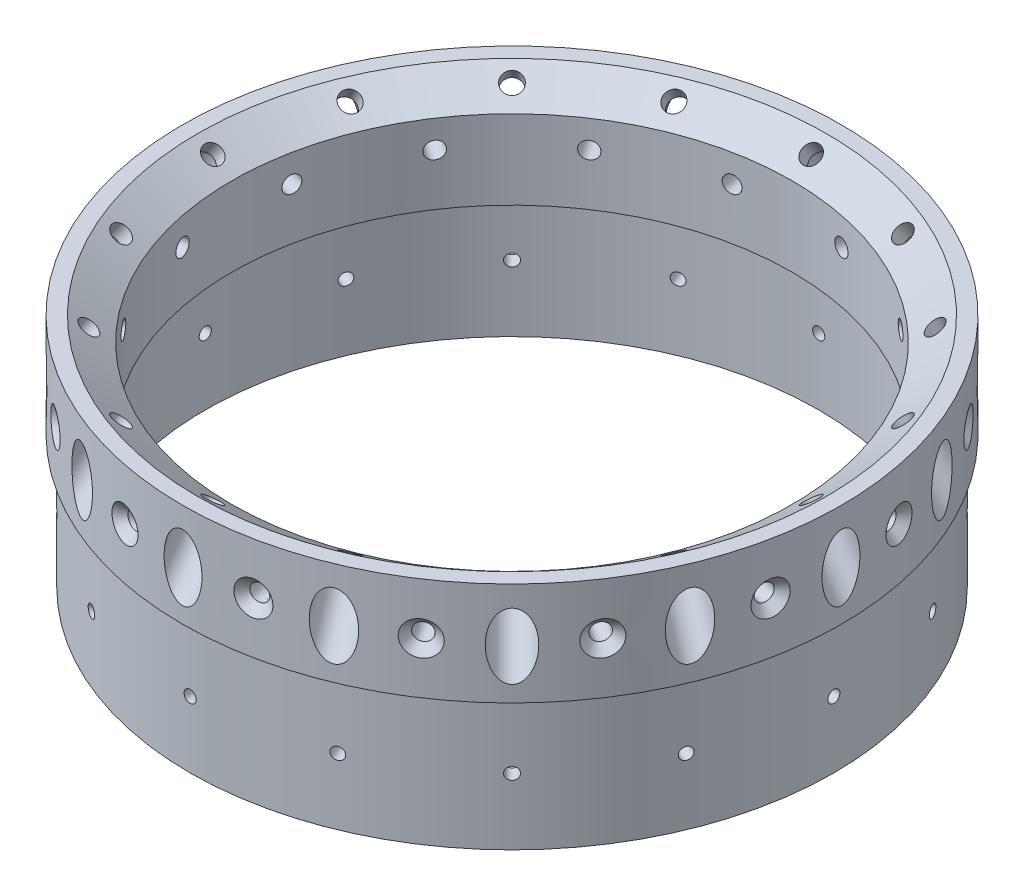
from build123d import *

# Parameters (mm, degrees)
HOLE_START                = -3
SKETCH14_R                = 5
HOLE_EXTRUDE_1_DEPTH      = 150.91522103
SCREW_EXTRUDE_D           = 5
SCREW_HOLES_PATTERN_COUNT = 16
CUT_EXTRUDE1_REACH        = 197.903
CUT_EXTRUDE1_END_RADIUS   = 81
SKETCH16_R                = 1.6
CIRPATTERN1_COUNT         = 16
CIRPATTERN2_COUNT         = 16


with BuildPart() as part:
    # Main sketch → Main revolve (revolve)
    with BuildSketch(Plane.XY, mode=Mode.PRIVATE) as main_revolve_sk:
        Polygon((-85, -35), (-81, -35), (-81, 0), (-74, 0), (-74, 20.897302003), (-83, 27.199169847), (-87, 27.199169847), (-87, 0), (-85, 0), align=None)
    revolve(main_revolve_sk.sketch.rotate(Axis((0, 0, 0), (0, -1, 0)), 270), axis=Axis((0, 0, 0), (0, -1, 0)))

    # Sketch14 → Hole extrude 1 (cut)
    with BuildSketch(Plane(origin=(-18.526734454, -26.458918881, 0), x_dir=(0.8191520442889891, -0.5735764363510499, 0), z_dir=(-0.5735764363510499, -0.8191520442889891, 0)).offset(HOLE_START)):
        with Locations(Location((-78.707324234, 0, 0), (0, 0, 180))):
            Circle(SKETCH14_R)
    hole_extrude_1 = extrude(amount=HOLE_EXTRUDE_1_DEPTH, mode=Mode.SUBTRACT)

    # screw extrude (through all)
    with Locations(Plane(origin=(-81.279270691, 21.1432038, 0), x_dir=(-0.819152044289, 0.573576436351, 0), z_dir=(-0.573576436351, -0.819152044289, 0))):
        with Locations((0, 0)):
            screw_extrude = Hole(SCREW_EXTRUDE_D / 2)

    # Screw holes pattern: Hole extrude 1, screw extrude ×16 about axis
    screw_holes_pattern_axis = Axis((0, 0, 0), (0, 1, 0))
    add([hole_extrude_1.rotate(screw_holes_pattern_axis, i * 360 / SCREW_HOLES_PATTERN_COUNT) for i in range(1, SCREW_HOLES_PATTERN_COUNT)], mode=Mode.SUBTRACT)
    add([screw_extrude.rotate(screw_holes_pattern_axis, i * 360 / SCREW_HOLES_PATTERN_COUNT) for i in range(1, SCREW_HOLES_PATTERN_COUNT)], mode=Mode.SUBTRACT)

    # Cut-Extrude1: up to this cylinder (the profile starts outside it)
    cut_extrude1_end = Plane(origin=(0, -17.5, 0), z_dir=(0, 1, 0)) * Cylinder(CUT_EXTRUDE1_END_RADIUS, 558.806, mode=Mode.PRIVATE)
    # Sketch16 → Cut-Extrude1 (cut, up to the surface)
    with BuildSketch(Plane.XY.offset(85), mode=Mode.PRIVATE) as cut_extrude1_sk1:
        with Locations((0, -17.5)):
            Circle(SKETCH16_R)
    cut_extrude1_tool1 = extrude(cut_extrude1_sk1.sketch, amount=-CUT_EXTRUDE1_REACH, mode=Mode.PRIVATE) - cut_extrude1_end
    cut_extrude1 = cut_extrude1_tool1.solids().sort_by_distance((0, -17.5, 85))[0]
    add(cut_extrude1, mode=Mode.SUBTRACT)

    # CirPattern1: Cut-Extrude1 ×16 about axis
    cirpattern1_axis = Axis((0, -35, 0), (0, 1, 0))
    for i in range(1, CIRPATTERN1_COUNT):
        add(cut_extrude1.rotate(cirpattern1_axis, i * 360 / CIRPATTERN1_COUNT), mode=Mode.SUBTRACT)

    # Sketch17 → Cut-Revolve1 (revolve, cut)
    with BuildSketch(Plane(origin=(0, 13.599584924, 0), x_dir=(1, 0, 0), z_dir=(0, 1, 0)), mode=Mode.PRIVATE) as cut_revolve1_sk:
        Polygon((-85.328319395, -16.972858015), (-67.907865035, -13.507714198), (-68.344867356, -11.31075517), (-83.559015338, -14.328133764), (-86.206225844, -12.559324254), align=None)
    cut_revolve1 = revolve(cut_revolve1_sk.sketch.rotate(Axis((-67.907865035, 13.599584924, 13.507714198), (-0.9807852804032304, 0, 0.19509032201612866)), 55.561921896), axis=Axis((-67.907865035, 13.599584924, 13.507714198), (-0.9807852804032304, 0, 0.19509032201612866)), mode=Mode.SUBTRACT)

    # CirPattern2: Cut-Revolve1 ×16 about axis
    cirpattern2_axis = Axis((0, 0, 0), (0, 1, 0))
    for i in range(1, CIRPATTERN2_COUNT):
        add(cut_revolve1.rotate(cirpattern2_axis, i * 360 / CIRPATTERN2_COUNT), mode=Mode.SUBTRACT)


solid = part.part
